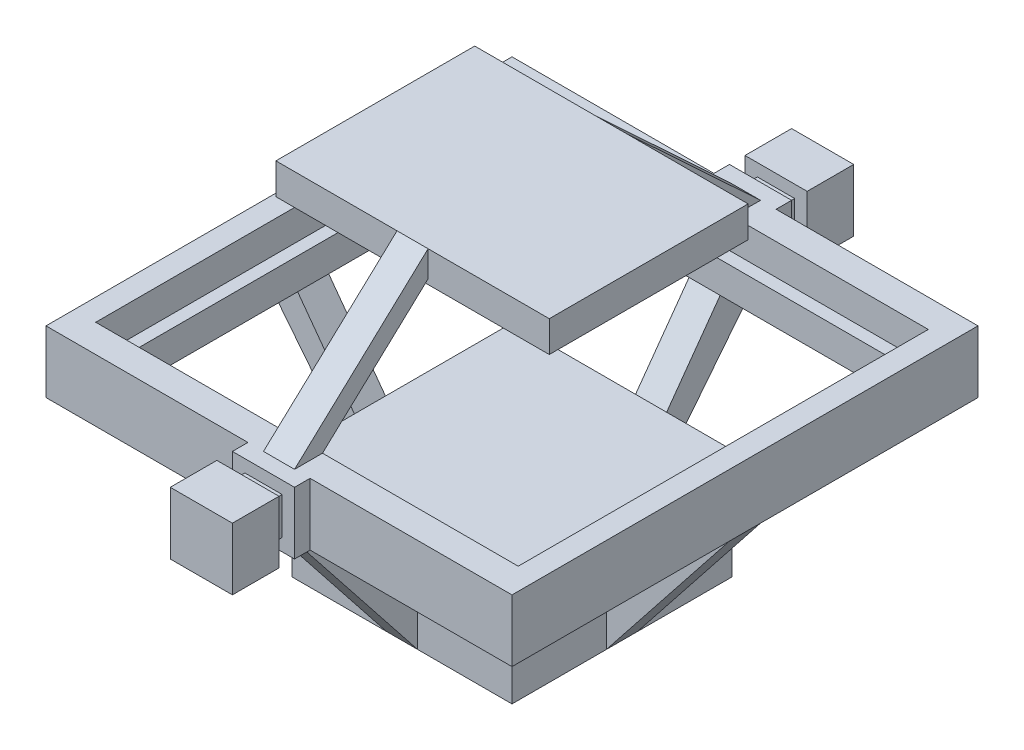
from build123d import *

# Parameters (mm, degrees)
SKETCH2_W            = 75
SKETCH2_H            = 75
BOSS_EXTRUDE1_DEPTH  = 5
SKETCH2_2_W          = 75
SKETCH2_2_H          = 75
BOSS_EXTRUDE2_DEPTH  = 5
SKETCH4_W            = 68
SKETCH4_H            = 66
CUT_EXTRUDE1_DEPTH   = 5
SKETCH5_W            = 64
SKETCH5_H            = 62
CUT_EXTRUDE2_DEPTH   = 5
SKETCH6_W            = 10
SKETCH6_H            = 10
BOSS_EXTRUDE3_DEPTH  = 2.5
SKETCH7_W            = 6
SKETCH7_H            = 6
BOSS_EXTRUDE4_DEPTH  = 2.5
SKETCH8_W            = 10
SKETCH8_H            = 10
BOSS_EXTRUDE5_DEPTH  = 7.5
SKETCH9_W            = 10
SKETCH9_H            = 10
BOSS_EXTRUDE6_DEPTH  = 2.5
SKETCH10_W           = 6
SKETCH10_H           = 6
BOSS_EXTRUDE7_DEPTH  = 2.5
SKETCH11_W           = 10
SKETCH11_H           = 10
BOSS_EXTRUDE8_DEPTH  = 7.5
SKETCH12_W           = 35.4
SKETCH12_H           = 35.4
BOSS_EXTRUDE9_DEPTH  = 17.7
SKETCH13_W           = 25.4
SKETCH13_H           = 25.4
CUT_EXTRUDE3_DEPTH   = 12.7
SKETCH14_W           = 44
SKETCH14_H           = 32
BOSS_EXTRUDE10_DEPTH = 5
BOSS_EXTRUDE11_DEPTH = 2.5
BOSS_EXTRUDE12_DEPTH = 2.5
BOSS_EXTRUDE13_DEPTH = 2.5
BOSS_EXTRUDE14_DEPTH = 2.5
BOSS_EXTRUDE15_DEPTH = 2.5
BOSS_EXTRUDE16_DEPTH = 2.5
BOSS_EXTRUDE17_DEPTH = 2.5
BOSS_EXTRUDE18_DEPTH = 2.5
BOSS_EXTRUDE19_DEPTH = 2.5
BOSS_EXTRUDE20_DEPTH = 2.5


with BuildPart() as part:
    # Sketch2 → Boss-Extrude1 (new body)
    with BuildSketch(Plane(origin=(0, 0, 0), x_dir=(1, 0, 0), z_dir=(0, 1, 0))):
        Rectangle(SKETCH2_W, SKETCH2_H)
    extrude(amount=BOSS_EXTRUDE1_DEPTH)

    # Sketch2<2> → Boss-Extrude2 (add)
    with BuildSketch(Plane(origin=(0, 0, 0), x_dir=(1, 0, 0), z_dir=(0, 1, 0))):
        Rectangle(SKETCH2_2_W, SKETCH2_2_H)
    extrude(amount=-BOSS_EXTRUDE2_DEPTH)

    # Sketch4 → Cut-Extrude1 (cut)
    with BuildSketch(Plane(origin=(0, 5, 0), x_dir=(1, 0, 0), z_dir=(0, 1, 0))):
        Rectangle(SKETCH4_W, SKETCH4_H)
    extrude(amount=-CUT_EXTRUDE1_DEPTH, mode=Mode.SUBTRACT)

    # Sketch5 → Cut-Extrude2 (cut)
    with BuildSketch(Plane(origin=(0, 0, 0), x_dir=(1, 0, 0), z_dir=(0, 1, 0))):
        Rectangle(SKETCH5_W, SKETCH5_H)
    extrude(amount=-CUT_EXTRUDE2_DEPTH, mode=Mode.SUBTRACT)

    # Sketch6 → Boss-Extrude3 (add)
    with BuildSketch(Plane.XY.offset(37.5)):
        Rectangle(SKETCH6_W, SKETCH6_H)
    extrude(amount=BOSS_EXTRUDE3_DEPTH)

    # Sketch7 → Boss-Extrude4 (add)
    with BuildSketch(Plane.XY.offset(40)):
        Rectangle(SKETCH7_W, SKETCH7_H)
    extrude(amount=BOSS_EXTRUDE4_DEPTH)

    # Sketch8 → Boss-Extrude5 (add)
    with BuildSketch(Plane.XY.offset(42.5)):
        Rectangle(SKETCH8_W, SKETCH8_H)
    extrude(amount=BOSS_EXTRUDE5_DEPTH)

    # Sketch9 → Boss-Extrude6 (add)
    with BuildSketch(Plane(origin=(0, 0, -37.5), x_dir=(-1, 0, 0), z_dir=(0, 0, -1))):
        Rectangle(SKETCH9_W, SKETCH9_H)
    extrude(amount=BOSS_EXTRUDE6_DEPTH)

    # Sketch10 → Boss-Extrude7 (add)
    with BuildSketch(Plane(origin=(0, 0, -40), x_dir=(-1, 0, 0), z_dir=(0, 0, -1))):
        Rectangle(SKETCH10_W, SKETCH10_H)
    extrude(amount=BOSS_EXTRUDE7_DEPTH)

    # Sketch11 → Boss-Extrude8 (add)
    with BuildSketch(Plane(origin=(0, 0, -42.5), x_dir=(-1, 0, 0), z_dir=(0, 0, -1))):
        Rectangle(SKETCH11_W, SKETCH11_H)
    extrude(amount=BOSS_EXTRUDE8_DEPTH)



with BuildPart() as body_2:
    # Sketch12 → Boss-Extrude9 (new body)
    with BuildSketch(Plane(origin=(0, -30, 0), x_dir=(1, 0, 0), z_dir=(0, 1, 0))):
        Rectangle(SKETCH12_W, SKETCH12_H)
    extrude(amount=BOSS_EXTRUDE9_DEPTH)

    # Sketch13 → Cut-Extrude3 (cut)
    with BuildSketch(Plane.XZ.offset(30)):
        Rectangle(SKETCH13_W, SKETCH13_H)
    extrude(amount=-CUT_EXTRUDE3_DEPTH, mode=Mode.SUBTRACT)


with BuildPart() as body_3:
    # Sketch14 → Boss-Extrude10 (new body)
    with BuildSketch(Plane(origin=(0, 25, 0), x_dir=(1, 0, 0), z_dir=(0, 1, 0))):
        Rectangle(SKETCH14_W, SKETCH14_H)
    extrude(amount=-BOSS_EXTRUDE10_DEPTH)


with BuildPart() as part_1:
    add(part.part)

    add(body_2.part)  # Boss-Extrude11 merges body 2
    # Sketch15 → Boss-Extrude11 (add)
    with BuildSketch(Plane.XY):
        Polygon((17.7, -30), (37.5, -5), (32, -5), (17.7, -24.5), align=None)
    extrude(amount=BOSS_EXTRUDE11_DEPTH)

    # Sketch15<2> → Boss-Extrude12 (add)
    with BuildSketch(Plane.XY):
        Polygon((17.7, -30), (37.5, -5), (32, -5), (17.7, -24.5), align=None)
    extrude(amount=-BOSS_EXTRUDE12_DEPTH)

    # Sketch17 → Boss-Extrude13 (add)
    with BuildSketch(Plane.XY):
        Polygon((-37.5, -5), (-17.7, -30), (-17.7, -24.5), (-32, -5), align=None)
    extrude(amount=BOSS_EXTRUDE13_DEPTH)

    # Sketch17<2> → Boss-Extrude14 (add)
    with BuildSketch(Plane.XY):
        Polygon((-37.5, -5), (-17.7, -30), (-17.7, -24.5), (-32, -5), align=None)
    extrude(amount=-BOSS_EXTRUDE14_DEPTH)


    add(body_3.part)  # Boss-Extrude15 merges body 3
    # Sketch18 → Boss-Extrude15 (add)
    with BuildSketch(Plane(origin=(0, 0, 0), x_dir=(0, 0, -1), z_dir=(1, 0, 0))):
        Polygon((16, 25), (37.5, 5), (33, 5), (16, 20.813953488), align=None)
    extrude(amount=BOSS_EXTRUDE15_DEPTH)

    # Sketch18<2> → Boss-Extrude16 (add)
    with BuildSketch(Plane(origin=(0, 0, 0), x_dir=(0, 0, -1), z_dir=(1, 0, 0))):
        Polygon((16, 25), (37.5, 5), (33, 5), (16, 20.813953488), align=None)
    extrude(amount=-BOSS_EXTRUDE16_DEPTH)

    # Sketch19 → Boss-Extrude17 (add)
    with BuildSketch(Plane(origin=(0, 0, 0), x_dir=(0, 0, -1), z_dir=(1, 0, 0))):
        Polygon((-16, 25), (-37.5, 5), (-33, 5), (-16, 20.813953488), align=None)
    extrude(amount=BOSS_EXTRUDE17_DEPTH)

    # Sketch19<2> → Boss-Extrude18 (add)
    with BuildSketch(Plane(origin=(0, 0, 0), x_dir=(0, 0, -1), z_dir=(1, 0, 0))):
        Polygon((-16, 25), (-37.5, 5), (-33, 5), (-16, 20.813953488), align=None)
    extrude(amount=-BOSS_EXTRUDE18_DEPTH)

    # Sketch20 → Boss-Extrude19 (add)
    with BuildSketch(Plane(origin=(0, 0, 0), x_dir=(0, 0, -1), z_dir=(1, 0, 0))):
        Polygon((-37.5, -5), (-17.7, -30), (-17.7, -23.5), (-31, -5), align=None)
        Polygon((17.7, -30), (37.5, -5), (31, -5), (17.7, -23.5), align=None)
    extrude(amount=BOSS_EXTRUDE19_DEPTH)

    # Sketch20<2> → Boss-Extrude20 (add)
    with BuildSketch(Plane(origin=(0, 0, 0), x_dir=(0, 0, -1), z_dir=(1, 0, 0))):
        Polygon((-37.5, -5), (-17.7, -30), (-17.7, -23.5), (-31, -5), align=None)
        Polygon((17.7, -30), (37.5, -5), (31, -5), (17.7, -23.5), align=None)
    extrude(amount=-BOSS_EXTRUDE20_DEPTH)


solid = part_1.part
